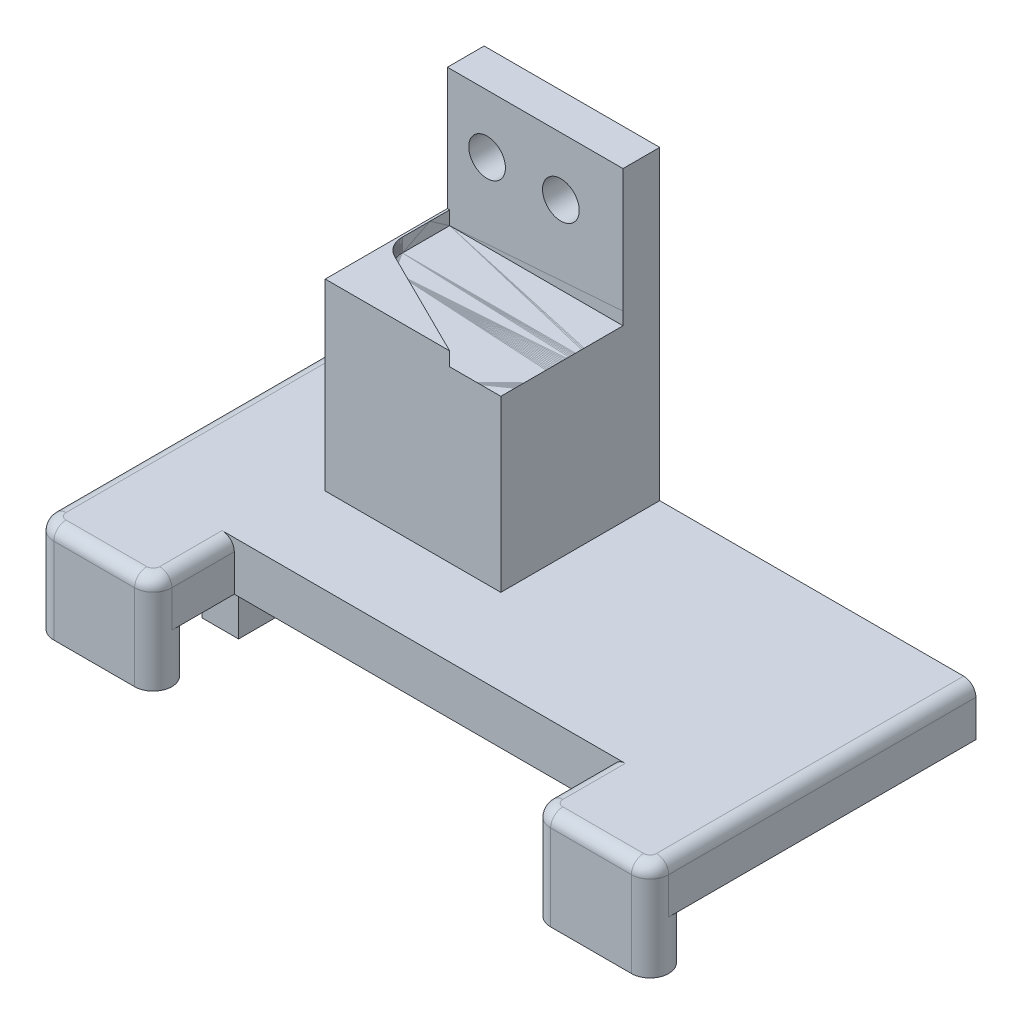
from build123d import *

# Parameters (mm, degrees)
BOSS_EXTRUDE1_DEPTH   = 4
BOSS_EXTRUDE1_2_DEPTH = 4
BOSS_EXTRUDE3_DEPTH   = 4
FILLET2_R             = 1
SKETCH4_W             = 14.347682942
SKETCH4_H             = 12.983957321
BOSS_EXTRUDE4_DEPTH   = 15
SKETCH6_W             = 14.347682942
SKETCH6_H             = 3
BOSS_EXTRUDE6_DEPTH   = 10
CUT_EXTRUDE1_REACH    = 49.733
SKETCH7_R             = 1.5
CAVITY2_START         = 21.87499999
CAVITY2_DEPTH         = 1.12500001
SKETCH8_W             = 3
SKETCH8_H             = 13
BOSS_EXTRUDE7_DEPTH   = 10
CUT_EXTRUDE2_REACH    = 71.123
SKETCH10_R            = 1.5


# Read off the part's stored shape, not the designer's step: Cavity2
with BuildPart() as part:
    # Sketch1 → Boss-Extrude1 (new body)
    with BuildSketch(Plane(origin=(0, 0, 0), x_dir=(1, 0, 0), z_dir=(0, 1, 0))):
        with BuildLine():
            Line((-23.6, 10.542278437), (-17, 10.542278437))
            ThreePointArc((-17, 10.542278437), (-15.475, 9.017278437), (-17, 7.492278437))
            Line((-17, 7.492278437), (-23.6, 7.492278437))
            ThreePointArc((-23.6, 7.492278437), (-25.125, 9.017278437), (-23.6, 10.542278437))
        make_face()
    extrude(amount=BOSS_EXTRUDE1_DEPTH)



with BuildPart() as body_2:
    # Sketch1 → Boss-Extrude1 2 (new body)
    with BuildSketch(Plane(origin=(0, 0, 0), x_dir=(1, 0, 0), z_dir=(0, 1, 0))):
        with BuildLine():
            Line((23.6, 7.492278437), (17, 7.492278437))
            ThreePointArc((17, 7.492278437), (15.475, 9.017278437), (17, 10.542278437))
            Line((17, 10.542278437), (23.6, 10.542278437))
            ThreePointArc((23.6, 10.542278437), (25.125, 9.017278437), (23.6, 7.492278437))
        make_face()
    extrude(amount=BOSS_EXTRUDE1_2_DEPTH)


with BuildPart() as part_1:
    add(part.part)

    add(body_2.part)  # Boss-Extrude3 merges body 2
    # Sketch3 → Boss-Extrude3 (add)
    with BuildSketch(Plane(origin=(0, 4, 0), x_dir=(1, 0, 0), z_dir=(0, 1, 0))):
        with BuildLine():
            ThreePointArc((15.475, 9.017278437), (15.921662159, 7.938940596), (17, 7.492278437))
            Line((17, 7.492278437), (23.6, 7.492278437))
            ThreePointArc((23.6, 7.492278437), (24.678337841, 7.938940596), (25.125, 9.017278437))
            Line((25.125, 9.017278437), (25.125, 17.305889592))
            Line((25.125, 17.305889592), (25.125, 34.117278437))
            Line((25.125, 34.117278437), (-25.125, 34.117278437))
            Line((-25.125, 34.117278437), (-25.125, 17.305889592))
            Line((-25.125, 17.305889592), (-25.125, 9.017278437))
            ThreePointArc((-25.125, 9.017278437), (-24.678337841, 10.095616278), (-23.6, 10.542278437))
            Line((-23.6, 10.542278437), (-17, 10.542278437))
            ThreePointArc((-17, 10.542278437), (-15.921662159, 10.095616278), (-15.475, 9.017278437))
            Line((-15.475, 9.017278437), (-15.475, 14.117278437))
            Line((-15.475, 14.117278437), (15.475, 14.117278437))
            Line((15.475, 14.117278437), (15.475, 9.017278437))
        make_face()
        with BuildLine():
            Line((-17, 10.542278437), (-23.6, 10.542278437))
            ThreePointArc((-23.6, 10.542278437), (-25.125, 9.017278437), (-23.6, 7.492278437))
            Line((-23.6, 7.492278437), (-17, 7.492278437))
            ThreePointArc((-17, 7.492278437), (-15.475, 9.017278437), (-17, 10.542278437))
        make_face()
    extrude(amount=BOSS_EXTRUDE3_DEPTH)

    # Fillet2
    fillet2_edges = [part_1.edges().sort_by_distance(p)[0] for p in [
        (-25.125, 8, -21.567278437),
        (15.475, 8, -11.567278437),
        (-24.678337841, 8, -7.938940596),
        (-20.3, 8, -7.492278437),
        (-15.921662159, 8, -7.938940596),
        (-15.475, 8, -11.567278437),
        (15.921662159, 8, -7.938940596),
        (20.3, 8, -7.492278437),
        (24.678337841, 8, -7.938940596),
        (25.125, 8, -21.567278437),
    ]]
    fillet(fillet2_edges, radius=FILLET2_R)

    # Sketch4 → Boss-Extrude4 (add)
    with BuildSketch(Plane(origin=(0, 8, 0), x_dir=(1, 0, 0), z_dir=(0, 1, 0))):
        with Locations((-7.885296824, 27.625299777)):
            Rectangle(SKETCH4_W, SKETCH4_H)
    extrude(amount=BOSS_EXTRUDE4_DEPTH)

    # Sketch6 → Boss-Extrude6 (add)
    with BuildSketch(Plane(origin=(0, 23, 0), x_dir=(1, 0, 0), z_dir=(0, 1, 0))):
        with Locations((-7.885296824, 32.617278437)):
            Rectangle(SKETCH6_W, SKETCH6_H)
    extrude(amount=BOSS_EXTRUDE6_DEPTH)

    # Sketch7 → Cut-Extrude1 (cut, up to next)
    with BuildSketch(Plane.XY.offset(-31.117278437), mode=Mode.PRIVATE) as cut_extrude1_sk1:
        with Locations((-11.819138295, 28.245)):
            Circle(SKETCH7_R)
    cut_extrude1_tool1 = extrude(cut_extrude1_sk1.sketch, amount=-CUT_EXTRUDE1_REACH, mode=Mode.PRIVATE) & part_1.part
    # Sketch7 → Cut-Extrude1 (cut, up to next)
    with BuildSketch(Plane.XY.offset(-31.117278437), mode=Mode.PRIVATE) as cut_extrude1_sk2:
        with Locations((-5.789138295, 28.245)):
            Circle(SKETCH7_R)
    cut_extrude1_tool2 = extrude(cut_extrude1_sk2.sketch, amount=-CUT_EXTRUDE1_REACH, mode=Mode.PRIVATE) & part_1.part
    add(cut_extrude1_tool1.solids().sort_by_distance((-11.819138, 28.245, -31.117278))[0], mode=Mode.SUBTRACT)
    add(cut_extrude1_tool2.solids().sort_by_distance((-5.789138, 28.245, -31.117278))[0], mode=Mode.SUBTRACT)

    # Cavity2 outline → Cavity2 (cut)
    with BuildSketch(Plane(origin=(0, 0, 0), x_dir=(1, 0, 0), z_dir=(0, 1, 0)).offset(CAVITY2_START)):
        Polygon((-0.711455353, 21.133321116), (-0.711455353, 31.117278437), (-14.875000136, 31.117278437), (-14.874999824, 29.504253116), (-14.874998603, 27.254253271), (-14.869868878, 27.115654486), (-14.854507644, 26.977814263), (-14.829001512, 26.841486537), (-14.793485992, 26.707417297), (-14.748156659, 26.57633996), (-14.693263575, 26.448972009), (-14.629105695, 26.326010144), (-14.55603366, 26.208127189), (-14.474448405, 26.095968178), (-14.384794172, 25.99014676), (-14.287564095, 25.89124194), (-14.183289029, 25.799794912), (-14.072538942, 25.716306013), (-13.955921523, 25.641232065), (-13.8340724, 25.574983827), (-4.891452092, 21.133285849), align=None)
    extrude(amount=CAVITY2_DEPTH, mode=Mode.SUBTRACT)

    # Sketch8 → Boss-Extrude7 (add)
    with BuildSketch(Plane.XZ.offset(-4)):
        with Locations((-23.625, -27.617278437)):
            Rectangle(SKETCH8_W, SKETCH8_H)
    extrude(amount=BOSS_EXTRUDE7_DEPTH)

    # Sketch10 → Cut-Extrude2 (cut, up to next)
    with BuildSketch(Plane.ZY.offset(25.125), mode=Mode.PRIVATE) as cut_extrude2_sk1:
        with Locations((-23.44448468, -2.644785648)):
            Circle(SKETCH10_R)
    cut_extrude2_tool1 = extrude(cut_extrude2_sk1.sketch, amount=-CUT_EXTRUDE2_REACH, mode=Mode.PRIVATE) & part_1.part
    # Sketch10 → Cut-Extrude2 (cut, up to next)
    with BuildSketch(Plane.ZY.offset(25.125), mode=Mode.PRIVATE) as cut_extrude2_sk2:
        with Locations((-31.44448468, -2.644785648)):
            Circle(SKETCH10_R)
    cut_extrude2_tool2 = extrude(cut_extrude2_sk2.sketch, amount=-CUT_EXTRUDE2_REACH, mode=Mode.PRIVATE) & part_1.part
    add(cut_extrude2_tool1.solids().sort_by_distance((-25.125, -2.644786, -23.444485))[0], mode=Mode.SUBTRACT)
    add(cut_extrude2_tool2.solids().sort_by_distance((-25.125, -2.644786, -31.444485))[0], mode=Mode.SUBTRACT)


solid = part_1.part
